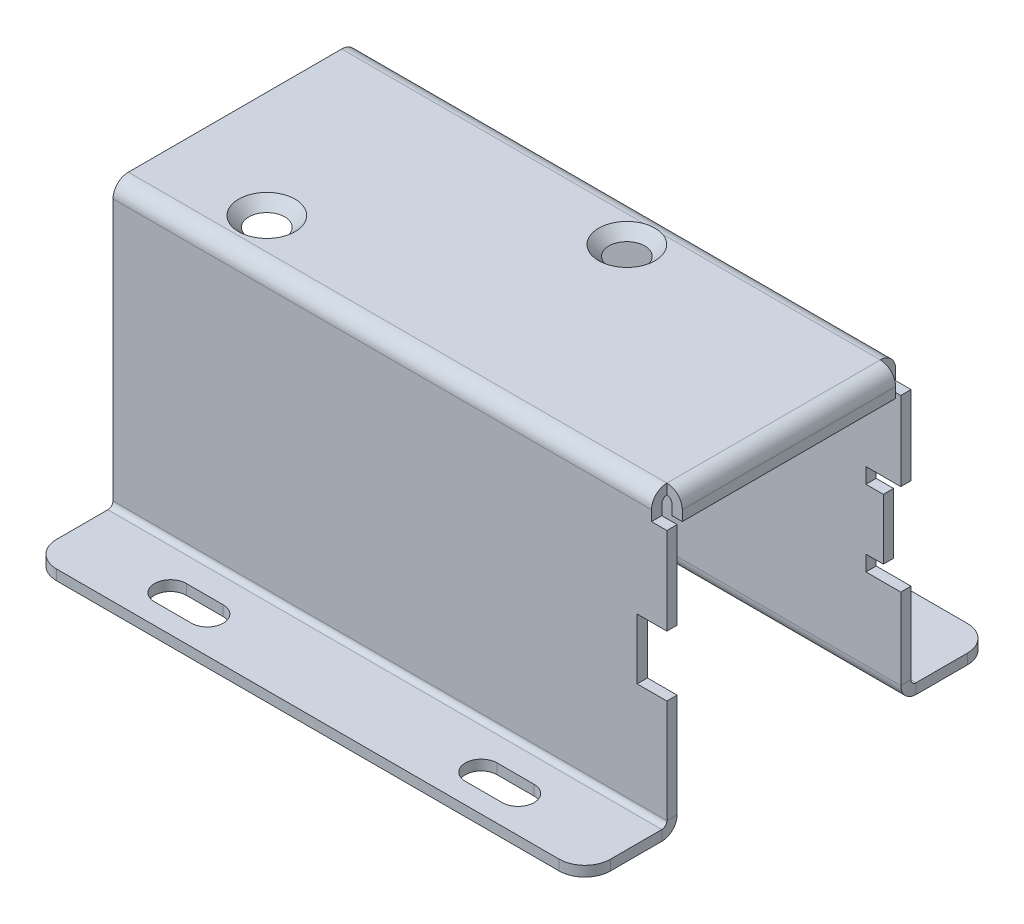
from build123d import *

# Parameters (mm, degrees)
SKETCH1_W                      = 54
SKETCH1_H                      = 23.8
BASE_FLANGE1_DEPTH             = 1
EDGE_FLANGE1_STRIP_W           = 5
EDGE_FLANGE1_STRIP_H           = 1
EDGE_FLANGE1_STRIP_CUT_DEPTH   = 54
EDGE_FLANGE1_STRIP_2_W         = 5
EDGE_FLANGE1_STRIP_2_H         = 1
EDGE_FLANGE1_STRIP_CUT_2_DEPTH = 54
EDGE_FLANGE1_DEPTH             = 54
EDGE_FLANGE1_BEND_DEPTH        = 54
EDGE_FLANGE2_STRIP_W           = 5
EDGE_FLANGE2_STRIP_H           = 1
EDGE_FLANGE2_STRIP_CUT_DEPTH   = 20.8
EDGE_FLANGE2_DEPTH             = 20.8
CUT_EXTRUDE1_START             = -1.5
CUT_EXTRUDE1_DEPTH             = 1.5
CUT_EXTRUDE2_START             = -1.5
CUT_EXTRUDE2_DEPTH             = 1.5
EDGE_FLANGE3_STRIP_W           = 5
EDGE_FLANGE3_STRIP_H           = 1
EDGE_FLANGE3_STRIP_CUT_DEPTH   = 54
EDGE_FLANGE3_STRIP_2_W         = 5
EDGE_FLANGE3_STRIP_2_H         = 1
EDGE_FLANGE3_STRIP_CUT_2_DEPTH = 54
EDGE_FLANGE3_DEPTH             = 54
EDGE_FLANGE3_BEND_DEPTH        = 54
BREAK_CORNER1_START            = -28.5
BREAK_CORNER1_DEPTH            = 1
CUT_EXTRUDE3_DEPTH             = 10
CUT_EXTRUDE4_DEPTH             = 2
CUT_EXTRUDE4_DEPTH_BACK        = 2
BREAK_CORNER2_START            = -28.5
BREAK_CORNER2_DEPTH            = 1
CUT_EXTRUDE5_DEPTH             = 1
SKETCH26_W                     = 2.9
SKETCH26_H                     = 5.9
CUT_EXTRUDE6_DEPTH             = 1
SKETCH27_R                     = 1.6
CUT_EXTRUDE7_DEPTH             = 1
MOVE_FACE1_BY                  = 0.15
MOVE_FACE1_2_BY                = 0.15
CHAMFER1_SIZE                  = 1
CHAMFER2_SIZE                  = 1


# Read off the part's stored shape, not the designer's step: Break-Corner1, Break-Corner2
# Sheet-metal steps are written as plain solids
# Some blends are built 0.0001 mm under size
with BuildPart() as part:
    # Sketch1 → Base-Flange1 (new body)
    with BuildSketch(Plane(origin=(0, 0, 0), x_dir=(1, 0, 0), z_dir=(0, 1, 0))):
        Rectangle(SKETCH1_W, SKETCH1_H)
    extrude(amount=-BASE_FLANGE1_DEPTH)

    # Edge-Flange1 strip (across the edge) → Edge-Flange1 strip cut (cut)
    with BuildSketch(Plane(origin=(27, -1, 11.9), x_dir=(0, 0, -1), z_dir=(-1, 0, 0))):
        with Locations((-1, -0.5)):
            Rectangle(EDGE_FLANGE1_STRIP_W, EDGE_FLANGE1_STRIP_H)
    extrude(amount=EDGE_FLANGE1_STRIP_CUT_DEPTH, mode=Mode.SUBTRACT)

    # Edge-Flange1 strip 2 (across the edge) → Edge-Flange1 strip cut 2 (cut)
    with BuildSketch(Plane(origin=(-27, -1, -11.9), x_dir=(0, 0, 1), z_dir=(1, 0, 0))):
        with Locations((-1, -0.5)):
            Rectangle(EDGE_FLANGE1_STRIP_2_W, EDGE_FLANGE1_STRIP_2_H)
    extrude(amount=EDGE_FLANGE1_STRIP_CUT_2_DEPTH, mode=Mode.SUBTRACT)

    # Edge-Flange1 section (across the edge) → Edge-Flange1 (add)
    with BuildSketch(Plane(origin=(27, -1, 11.9), x_dir=(0, 0, -1), z_dir=(-1, 0, 0))):
        with BuildLine():
            Line((0, 0.5), (0, 27.5))
            Line((0, 27.5), (1, 27.5))
            Line((1, 27.5), (1, 0.5))
            ThreePointArc((1, 0.5), (1.146446609, 0.146446609), (1.5, 0))
            Line((1.5, 0), (1.5, -1))
            ThreePointArc((1.5, -1), (0.439339828, -0.560660172), (0, 0.5))
        make_face()
    extrude(amount=EDGE_FLANGE1_DEPTH)

    # Edge-Flange1 section 2 (across the edge) → Edge-Flange1 bend (add)
    with BuildSketch(Plane(origin=(-27, -1, -11.9), x_dir=(0, 0, 1), z_dir=(1, 0, 0))):
        with BuildLine():
            Line((0, 0.5), (0, 27.5))
            Line((0, 27.5), (1, 27.5))
            Line((1, 27.5), (1, 0.5))
            ThreePointArc((1, 0.5), (1.146446609, 0.146446609), (1.5, 0))
            Line((1.5, 0), (1.5, -1))
            ThreePointArc((1.5, -1), (0.439339828, -0.560660172), (0, 0.5))
        make_face()
    extrude(amount=EDGE_FLANGE1_BEND_DEPTH)

    # Edge-Flange2 strip (across the edge) → Edge-Flange2 strip cut (cut)
    with BuildSketch(Plane(origin=(27, -1, -10.4), x_dir=(-1, 0, 0), z_dir=(0, 0, 1))):
        with Locations((-1, -0.5)):
            Rectangle(EDGE_FLANGE2_STRIP_W, EDGE_FLANGE2_STRIP_H)
    extrude(amount=EDGE_FLANGE2_STRIP_CUT_DEPTH, mode=Mode.SUBTRACT)

    # Edge-Flange2 section (across the edge) → Edge-Flange2 (add)
    with BuildSketch(Plane(origin=(27, -1, -10.4), x_dir=(-1, 0, 0), z_dir=(0, 0, 1))):
        with BuildLine():
            Line((0, 0.5), (0, 1.5))
            Line((0, 1.5), (1, 1.5))
            Line((1, 1.5), (1, 0.5))
            ThreePointArc((1, 0.5), (1.146446609, 0.146446609), (1.5, 0))
            Line((1.5, 0), (1.5, -1))
            ThreePointArc((1.5, -1), (0.439339828, -0.560660172), (0, 0.5))
        make_face()
    extrude(amount=EDGE_FLANGE2_DEPTH)

    # Sketch15 → Cut-Extrude1 (cut)
    with BuildSketch(Plane(origin=(0, 0, -11.9), x_dir=(-1, 0, 0), z_dir=(0, 0, -1)).offset(CUT_EXTRUDE1_START)):
        Polygon((-27, -2.5), (-25.5, -2.5), (-25.5, 0), (-28.102393481, 0), (-28.102393481, -2.5), align=None)
    extrude(amount=CUT_EXTRUDE1_DEPTH, mode=Mode.SUBTRACT)

    # Sketch16 → Cut-Extrude2 (cut)
    with BuildSketch(Plane.XY.offset(11.9).offset(CUT_EXTRUDE2_START)):
        Polygon((25.5, -2.5), (25.5, 0), (28.102393481, 0), (28.102393481, -2.5), (27, -2.5), align=None)
    extrude(amount=CUT_EXTRUDE2_DEPTH, mode=Mode.SUBTRACT)

    # Edge-Flange3 strip (across the edge) → Edge-Flange3 strip cut (cut)
    with BuildSketch(Plane(origin=(-27, -28.5, 11.9), x_dir=(0, 1, 0), z_dir=(1, 0, 0))):
        with Locations((-1, -0.5)):
            Rectangle(EDGE_FLANGE3_STRIP_W, EDGE_FLANGE3_STRIP_H)
    extrude(amount=EDGE_FLANGE3_STRIP_CUT_DEPTH, mode=Mode.SUBTRACT)

    # Edge-Flange3 strip 2 (across the edge) → Edge-Flange3 strip cut 2 (cut)
    with BuildSketch(Plane(origin=(27, -28.5, -11.9), x_dir=(0, 1, 0), z_dir=(-1, 0, 0))):
        with Locations((-1, -0.5)):
            Rectangle(EDGE_FLANGE3_STRIP_2_W, EDGE_FLANGE3_STRIP_2_H)
    extrude(amount=EDGE_FLANGE3_STRIP_CUT_2_DEPTH, mode=Mode.SUBTRACT)

    # Edge-Flange3 section (across the edge) → Edge-Flange3 (add)
    with BuildSketch(Plane(origin=(-27, -28.5, 11.9), x_dir=(0, 1, 0), z_dir=(1, 0, 0))):
        with BuildLine():
            Line((0, 0.5), (0, 8))
            Line((0, 8), (1, 8))
            Line((1, 8), (1, 0.5))
            ThreePointArc((1, 0.5), (1.146446609, 0.146446609), (1.5, 0))
            Line((1.5, 0), (1.5, -1))
            ThreePointArc((1.5, -1), (0.439339828, -0.560660172), (0, 0.5))
        make_face()
    extrude(amount=EDGE_FLANGE3_DEPTH)

    # Edge-Flange3 section 2 (across the edge) → Edge-Flange3 bend (add)
    with BuildSketch(Plane(origin=(27, -28.5, -11.9), x_dir=(0, 1, 0), z_dir=(-1, 0, 0))):
        with BuildLine():
            Line((0, 0.5), (0, 8))
            Line((0, 8), (1, 8))
            Line((1, 8), (1, 0.5))
            ThreePointArc((1, 0.5), (1.146446609, 0.146446609), (1.5, 0))
            Line((1.5, 0), (1.5, -1))
            ThreePointArc((1.5, -1), (0.439339828, -0.560660172), (0, 0.5))
        make_face()
    extrude(amount=EDGE_FLANGE3_BEND_DEPTH)

    # Break-Corner1 outline → Break-Corner1 (cut)
    with BuildSketch(Plane(origin=(0, 0, 0), x_dir=(1, 0, 0), z_dir=(0, 1, 0)).offset(BREAK_CORNER1_START)):
        with BuildLine():
            Line((-27, -19.9), (-24.5, -19.9))
            ThreePointArc((-24.5, -19.9), (-26.267766953, -19.167766953), (-27, -17.4))
            Line((-27, -17.4), (-27, -19.9))
        make_face()
        with BuildLine():
            ThreePointArc((27, -17.4), (26.267766953, -19.167766953), (24.5, -19.9))
            Line((24.5, -19.9), (27, -19.9))
            Line((27, -19.9), (27, -17.4))
        make_face()
        with BuildLine():
            Line((27, 19.9), (24.5, 19.9))
            ThreePointArc((24.5, 19.9), (26.267766953, 19.167766953), (27, 17.4))
            Line((27, 17.4), (27, 19.9))
        make_face()
        with BuildLine():
            ThreePointArc((-27, 17.4), (-26.267766953, 19.167766953), (-24.5, 19.9))
            Line((-24.5, 19.9), (-27, 19.9))
            Line((-27, 19.9), (-27, 17.4))
        make_face()
    extrude(amount=BREAK_CORNER1_DEPTH, mode=Mode.SUBTRACT)

    # Sketch23 → Cut-Extrude3 (cut)
    with BuildSketch(Plane(origin=(0, -27.5, 0), x_dir=(1, 0, 0), z_dir=(0, 1, 0))):
        with BuildLine():
            Line((13.35, 17.9), (16.95, 17.9))
            ThreePointArc((16.95, 17.9), (18.5, 16.35), (16.95, 14.8))
            Line((16.95, 14.8), (13.35, 14.8))
            ThreePointArc((13.35, 14.8), (11.8, 16.35), (13.35, 17.9))
        make_face()
        with BuildLine():
            Line((-13.35, 14.8), (-16.95, 14.8))
            ThreePointArc((-16.95, 14.8), (-18.5, 16.35), (-16.95, 17.9))
            Line((-16.95, 17.9), (-13.35, 17.9))
            ThreePointArc((-13.35, 17.9), (-11.8, 16.35), (-13.35, 14.8))
        make_face()
        with BuildLine():
            Line((13.35, -17.9), (16.95, -17.9))
            ThreePointArc((16.95, -17.9), (18.5, -16.35), (16.95, -14.8))
            Line((16.95, -14.8), (13.35, -14.8))
            ThreePointArc((13.35, -14.8), (11.8, -16.35), (13.35, -17.9))
        make_face()
        with BuildLine():
            Line((-13.35, -14.8), (-16.95, -14.8))
            ThreePointArc((-16.95, -14.8), (-18.5, -16.35), (-16.95, -17.9))
            Line((-16.95, -17.9), (-13.35, -17.9))
            ThreePointArc((-13.35, -17.9), (-11.8, -16.35), (-13.35, -14.8))
        make_face()
    extrude(amount=-CUT_EXTRUDE3_DEPTH, mode=Mode.SUBTRACT)

    # Sketch24 → Cut-Extrude4 (cut, two sides: drawn at the far end of the back side and taken through both)
    with BuildSketch(Plane(origin=(0, 0, -11.9), x_dir=(-1, 0, 0), z_dir=(0, 0, -1)).offset(-CUT_EXTRUDE4_DEPTH_BACK)):
        with BuildLine():
            Line((27, -28.5), (20.7, -28.5))
            Line((20.7, -28.5), (20.7, -26))
            ThreePointArc((20.7, -26), (21.432233047, -24.232233047), (23.2, -23.5))
            Line((23.2, -23.5), (27, -23.5))
            Line((27, -23.5), (27, -28.5))
        make_face()
    extrude(amount=CUT_EXTRUDE4_DEPTH + CUT_EXTRUDE4_DEPTH_BACK, mode=Mode.SUBTRACT)

    # Break-Corner2 outline → Break-Corner2 (add)
    with BuildSketch(Plane(origin=(0, 0, 0), x_dir=(1, 0, 0), z_dir=(0, 1, 0)).offset(BREAK_CORNER2_START)):
        with BuildLine():
            Line((-20.7, 13.9), (-22.2, 13.9))
            ThreePointArc((-22.2, 13.9), (-21.139339828, 13.460660172), (-20.7, 12.4))
            Line((-20.7, 12.4), (-20.7, 13.9))
        make_face()
    extrude(amount=BREAK_CORNER2_DEPTH)

    # Sketch25 → Cut-Extrude5 (cut)
    with BuildSketch(Plane.XY.offset(-10.9)):
        Polygon((27, -10.2), (23.6, -10.2), (23.6, -11.7), (25.3, -11.7), (25.3, -17.6), (23.6, -17.6), (23.6, -19.1), (27, -19.1), align=None)
    extrude(amount=-CUT_EXTRUDE5_DEPTH, mode=Mode.SUBTRACT)

    # Sketch26 → Cut-Extrude6 (cut)
    with BuildSketch(Plane.XY.offset(11.9)):
        with Locations((25.55, -13.95)):
            Rectangle(SKETCH26_W, SKETCH26_H)
    extrude(amount=-CUT_EXTRUDE6_DEPTH, mode=Mode.SUBTRACT)

    # Sketch27 → Cut-Extrude7 (cut)
    with BuildSketch(Plane(origin=(0, 0, 0), x_dir=(1, 0, 0), z_dir=(0, 1, 0))):
        with Locations(Location((-16.6, -7.3, 0), (0, 0, 270))):
            Circle(SKETCH27_R)
        with Locations(Location((3.4, 7.8, 0), (0, 0, 270))):
            Circle(SKETCH27_R)
    extrude(amount=-CUT_EXTRUDE7_DEPTH, mode=Mode.SUBTRACT)

    # Move Face1: a curved face moved inward by 0.15
    add(Solid.thicken(part.faces().sort_by_distance((3.4, -0.5, -9.4))[0], -MOVE_FACE1_BY), mode=Mode.SUBTRACT)

    # Move Face1 2: a curved face moved inward by 0.15
    add(Solid.thicken(part.faces().sort_by_distance((-16.6, -0.5, 5.7))[0], -MOVE_FACE1_2_BY), mode=Mode.SUBTRACT)

    # Chamfer1
    chamfer1_edges = [part.edges().sort_by_distance(p)[0] for p in [
        (-16.6, 0, 5.55),
    ]]
    chamfer(chamfer1_edges, length=CHAMFER1_SIZE - 0.0001)  # a hair under: the kernel refuses the full size

    # Chamfer2
    # the kernel refuses this chamfer: 1 mm, written as the material it takes off along each edge
    with BuildSketch(Plane(origin=(3.4, 0, -7.8), x_dir=(0, 0, 1), z_dir=(-1, 0, 0))) as chamfer2_piece_1:
        Polygon((1.75 + CHAMFER2_SIZE, 0), (1.75, -CHAMFER2_SIZE), (1.75, 0), align=None)
    revolve(axis=Axis((3.4, 0, -7.8), (0, 1, 0)), mode=Mode.SUBTRACT)


solid = part.part
